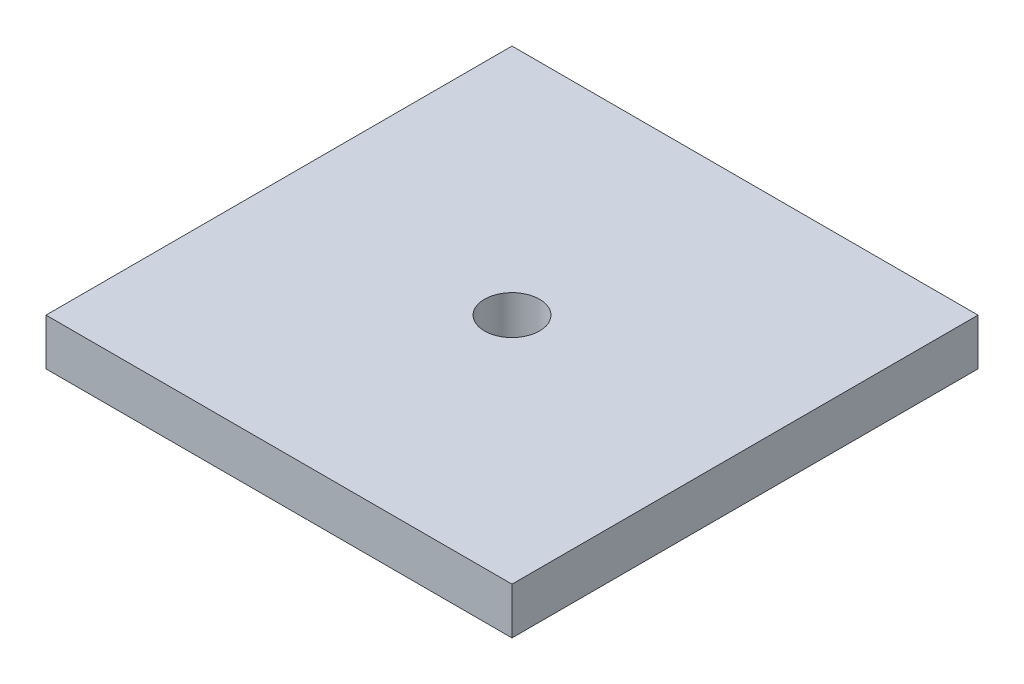
from build123d import *

# Parameters (mm, degrees)
SKETCH1_W           = 127
SKETCH1_H           = 127
SKETCH1_R           = 7.5057
BOSS_EXTRUDE1_DEPTH = 12.7


with BuildPart() as part:
    # Sketch1 → Boss-Extrude1 (new body)
    with BuildSketch(Plane(origin=(0, 0, 0), x_dir=(1, 0, 0), z_dir=(0, 1, 0))):
        Rectangle(SKETCH1_W, SKETCH1_H)
        Circle(SKETCH1_R, mode=Mode.SUBTRACT)
    extrude(amount=BOSS_EXTRUDE1_DEPTH)


solid = part.part
